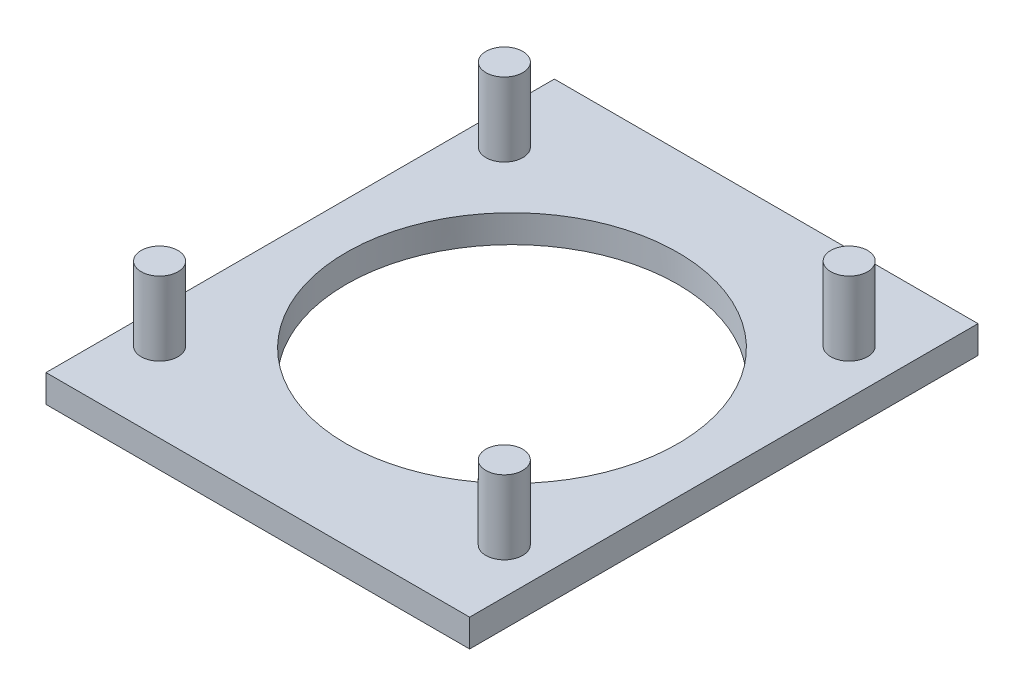
from build123d import *

# Parameters (mm, degrees)
SKETCH1_W           = 46
SKETCH1_H           = 55.2
BOSS_EXTRUDE1_DEPTH = 3
SKETCH3_R           = 18
CUT_EXTRUDE2_DEPTH  = 8
SKETCH5_R           = 2
BOSS_EXTRUDE2_DEPTH = 8


with BuildPart() as part:
    # Sketch1 → Boss-Extrude1 (new body)
    with BuildSketch(Plane(origin=(0, 0, 0), x_dir=(1, 0, 0), z_dir=(0, 1, 0))):
        Rectangle(SKETCH1_W, SKETCH1_H)
    extrude(amount=BOSS_EXTRUDE1_DEPTH)

    # Sketch3 → Cut-Extrude2 (cut)
    with BuildSketch(Plane(origin=(0, 3, 0), x_dir=(1, 0, 0), z_dir=(0, 1, 0))):
        Circle(SKETCH3_R)
    extrude(amount=-CUT_EXTRUDE2_DEPTH, mode=Mode.SUBTRACT)

    # Sketch5 → Boss-Extrude2 (add)
    with BuildSketch(Plane(origin=(0, 3, 0), x_dir=(1, 0, 0), z_dir=(0, 1, 0))):
        with Locations((-19.317913276, 18.489975821)):
            Circle(SKETCH5_R)
        with Locations((18.122086724, 18.489975821)):
            Circle(SKETCH5_R)
        with Locations((-19.317913276, -18.950024179)):
            Circle(SKETCH5_R)
        with Locations((18.084134894, -18.924464602)):
            Circle(SKETCH5_R)
    extrude(amount=BOSS_EXTRUDE2_DEPTH)


solid = part.part
